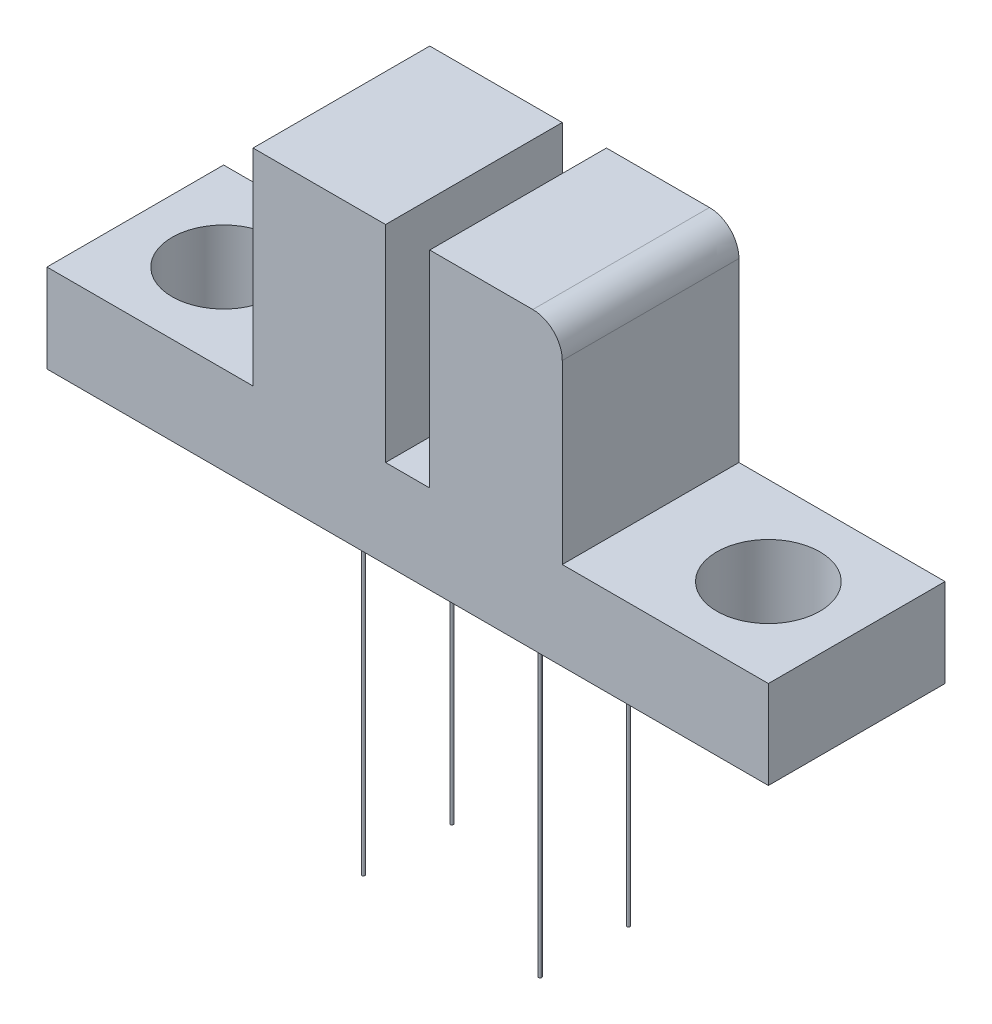
from build123d import *

# Parameters (mm, degrees)
CROQUIS1_W              = 24.5
CROQUIS1_H              = 6
CROQUIS1_R              = 1.75
SALIENTE_EXTRUIR1_DEPTH = 3
CROQUIS2_W              = 4.5
CROQUIS2_H              = 6
SALIENTE_EXTRUIR2_DEPTH = 7
REDONDEO1_SIZE          = 1
CROQUIS3_R              = 0.05
SALIENTE_EXTRUIR3_DEPTH = 11


with BuildPart() as part:
    # Croquis1 → Saliente-Extruir1 (new body)
    with BuildSketch(Plane(origin=(0, 0, 0), x_dir=(1, 0, 0), z_dir=(0, 1, 0))):
        with Locations((-12.25, -3)):
            Rectangle(CROQUIS1_W, CROQUIS1_H)
        with Locations(Location((-21.5, -3, 0), (0, 0, 270))):
            Circle(CROQUIS1_R, mode=Mode.SUBTRACT)
        with Locations(Location((-3, -3, 0), (0, 0, 90))):
            Circle(CROQUIS1_R, mode=Mode.SUBTRACT)
    extrude(amount=SALIENTE_EXTRUIR1_DEPTH)

    # Croquis2 → Saliente-Extruir2 (add)
    with BuildSketch(Plane(origin=(0, 3, 0), x_dir=(1, 0, 0), z_dir=(0, 1, 0))):
        with Locations((-15.25, -3)):
            Rectangle(CROQUIS2_W, CROQUIS2_H)
        with Locations((-9.25, -3)):
            Rectangle(CROQUIS2_W, CROQUIS2_H)
    extrude(amount=SALIENTE_EXTRUIR2_DEPTH)

    # Redondeo1
    # a fillet whose section is not a circle: 1 mm, written as the material it takes off along each edge
    with BuildSketch(Plane(origin=(-7, 10, -2.5), x_dir=(0, -1, 0), z_dir=(0, 0, 1))) as redondeo1_piece_1:
        with BuildLine():
            Bezier((REDONDEO1_SIZE, 0), (0, 0), (0, -REDONDEO1_SIZE), weights=[1, 0.707106781, 1])
            Line((0, -REDONDEO1_SIZE), (0, 0))
            Line((0, 0), (REDONDEO1_SIZE, 0))
        make_face()
    extrude(amount=11, mode=Mode.SUBTRACT)

    # Croquis3 → Saliente-Extruir3 (add)
    with BuildSketch(Plane.XZ):
        with Locations(Location((-15.25, 4.5, 0), (0, 0, 270))):
            Circle(CROQUIS3_R)
        with Locations(Location((-15.25, 1.5, 0), (0, 0, 90))):
            Circle(CROQUIS3_R)
        with Locations(Location((-9.25, 4.5, 0), (0, 0, 90))):
            Circle(CROQUIS3_R)
        with Locations(Location((-9.25, 1.5, 0), (0, 0, 270))):
            Circle(CROQUIS3_R)
    extrude(amount=SALIENTE_EXTRUIR3_DEPTH)


solid = part.part
